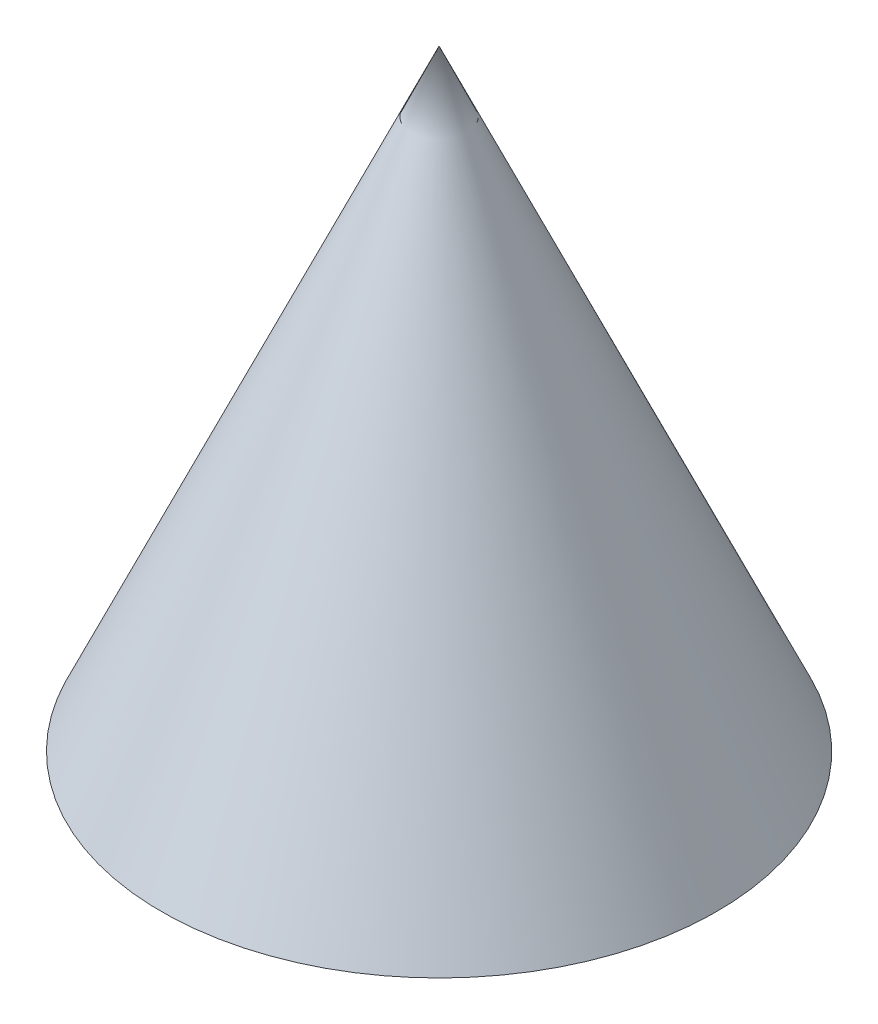
from build123d import *

# Parameters (mm, degrees)
SHELL_1_T = -1


with BuildPart() as part:
    # 草图1 → 旋转1 (revolve)
    with BuildSketch(Plane.XY):
        Polygon((0, 110), (50, 0), (0, 0), align=None)
    revolve(axis=Axis((0, 0, 0), (0, 1, 0)))

    # 抽壳1
    shell_1_openings = [part.faces().sort_by_distance(p)[0] for p in [
        (0, 0, 0),
    ]]
    offset(amount=SHELL_1_T, openings=shell_1_openings, kind=Kind.INTERSECTION)


solid = part.part
